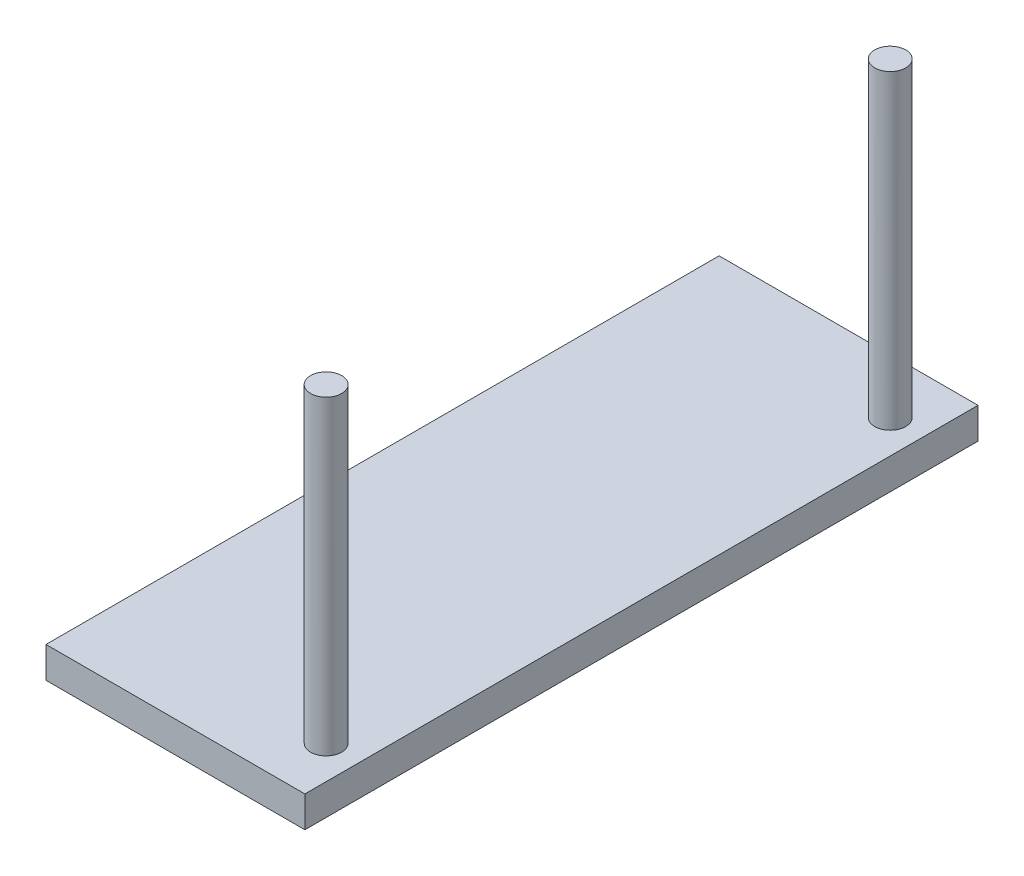
from build123d import *

# Parameters (mm, degrees)
SKETCH1_W           = 25
SKETCH1_H           = 65
BOSS_EXTRUDE1_DEPTH = 3
SKETCH2_R           = 1.5
BOSS_EXTRUDE2_DEPTH = 30


with BuildPart() as part:
    # Sketch1 → Boss-Extrude1 (new body)
    with BuildSketch(Plane(origin=(0, 0, 0), x_dir=(1, 0, 0), z_dir=(0, 1, 0))):
        Rectangle(SKETCH1_W, SKETCH1_H)
    extrude(amount=BOSS_EXTRUDE1_DEPTH)

    # Sketch2 → Boss-Extrude2 (add)
    with BuildSketch(Plane(origin=(0, 3, 0), x_dir=(1, 0, 0), z_dir=(0, 1, 0))):
        with Locations((9.289666573, 27.234893969)):
            Circle(SKETCH2_R)
        with Locations((9.289666573, -27.234893969)):
            Circle(SKETCH2_R)
    extrude(amount=BOSS_EXTRUDE2_DEPTH)


solid = part.part
